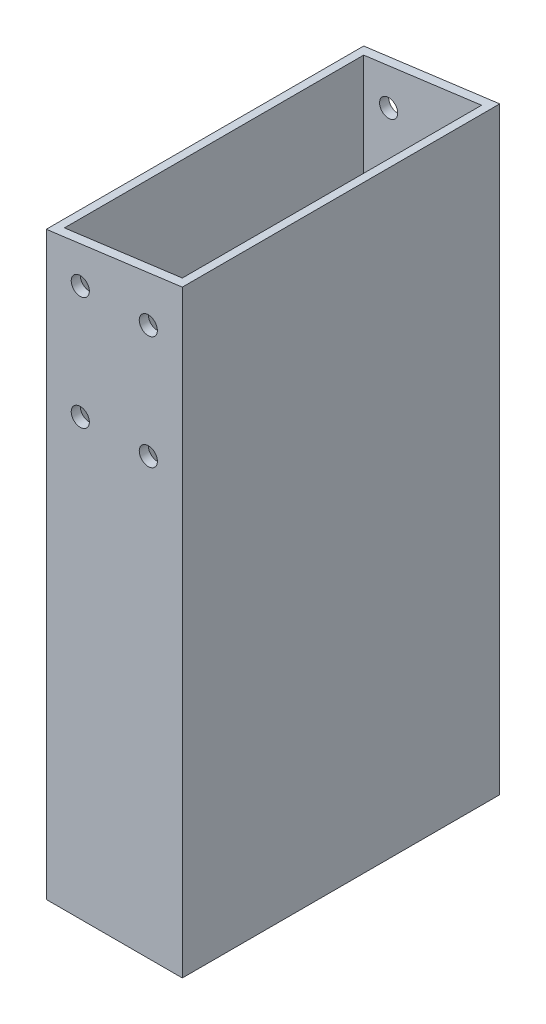
from build123d import *

# Parameters (mm, degrees)
SKETCH_1_W          = 30
SKETCH_1_H          = 750
SKETCH_1_R          = 2.000000003
SKETCH_1_R_2        = 2.000000001
EXTRUDE_2_DEPTH     = 70
SKETCH_2_W          = 26
SKETCH_2_H          = 66
CUT_EXTRUDE_3_DEPTH = 754.408919512
CUT_EXTRUDE_4_DEPTH = 382.772183376
SKETCH_4_W          = 30
SKETCH_4_H          = 922.920510985
CUT_EXTRUDE_5_DEPTH = 382.772183376


with BuildPart() as part:
    # 草图1 → 凸台-拉伸2 (new body)
    with BuildSketch(Plane.XY):
        Rectangle(SKETCH_1_W, SKETCH_1_H)
        with Locations((-7.5, 363.96878712)):
            Circle(SKETCH_1_R, mode=Mode.SUBTRACT)
        with Locations((7.5, 363.96878712)):
            Circle(SKETCH_1_R, mode=Mode.SUBTRACT)
        with Locations((-7.5, 338.96878712)):
            Circle(SKETCH_1_R, mode=Mode.SUBTRACT)
        with Locations((7.5, 338.96878712)):
            Circle(SKETCH_1_R, mode=Mode.SUBTRACT)
        with Locations((-7.5, -312.867936975)):
            Circle(SKETCH_1_R_2, mode=Mode.SUBTRACT)
        with Locations((7.5, -312.867936975)):
            Circle(SKETCH_1_R_2, mode=Mode.SUBTRACT)
        with Locations((-7.5, -337.867936975)):
            Circle(SKETCH_1_R_2, mode=Mode.SUBTRACT)
        with Locations((7.5, -337.867936975)):
            Circle(SKETCH_1_R_2, mode=Mode.SUBTRACT)
    extrude(amount=EXTRUDE_2_DEPTH)

    # 草图2 → 切除-拉伸3 (cut, through all)
    with BuildSketch(Plane.XZ.offset(375)):
        with Locations((0, 35)):
            Rectangle(SKETCH_2_W, SKETCH_2_H)
    extrude(amount=-CUT_EXTRUDE_3_DEPTH, mode=Mode.SUBTRACT)

    # 草图3 → 切除-拉伸4 (cut, through all)
    with BuildSketch(Plane.XY.offset(70)):
        Polygon((-15, 371.050425072), (15, 375), (15, 377.040830045), (-15, 377.040830045), align=None)
        Polygon((15, -375), (15, -347.1), (-15, -343.150425072), (-15, -375), align=None)
    extrude(amount=-CUT_EXTRUDE_4_DEPTH, mode=Mode.SUBTRACT)

    # 草图4 → 切除-拉伸5 (cut, through all)
    with BuildSketch(Plane(origin=(0, 0, 0), x_dir=(-1, 0, 0), z_dir=(0, 0, -1))):
        with Locations((0, -218.40983042)):
            Rectangle(SKETCH_4_W, SKETCH_4_H)
    extrude(amount=-CUT_EXTRUDE_5_DEPTH, mode=Mode.SUBTRACT)


solid = part.part
